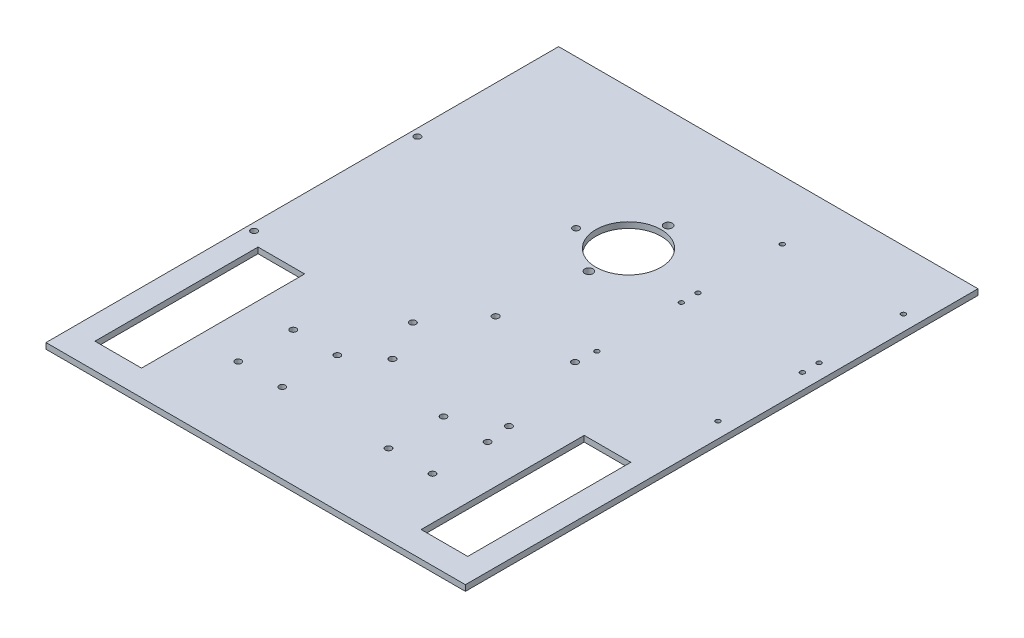
from build123d import *

# Parameters (mm, degrees)
SKETCH1_W           = 228.6
SKETCH1_H           = 279.4
BOSS_EXTRUDE1_DEPTH = 3.175
SKETCH3_R           = 1.7
SKETCH3_W           = 25.4
SKETCH3_H           = 88.9
CUT_EXTRUDE1_DEPTH  = 362.015789994
SKETCH4_R           = 17.78
SKETCH4_R_2         = 2.25
CUT_EXTRUDE2_DEPTH  = 362.015789994
SKETCH5_R           = 1.75
CUT_EXTRUDE3_DEPTH  = 362.015789994
SKETCH6_R           = 1.25
CUT_EXTRUDE4_DEPTH  = 362.015789994
SKETCH7_R           = 1.75
CUT_EXTRUDE5_DEPTH  = 362.015789994


with BuildPart() as part:
    # Sketch1 → Boss-Extrude1 (new body)
    with BuildSketch(Plane(origin=(0, 0, 0), x_dir=(1, 0, 0), z_dir=(0, 1, 0))):
        with Locations((114.3, 139.7)):
            Rectangle(SKETCH1_W, SKETCH1_H)
    extrude(amount=BOSS_EXTRUDE1_DEPTH)

    # Sketch3 → Cut-Extrude1 (cut, through all)
    with BuildSketch(Plane(origin=(0, 3.175, 0), x_dir=(1, 0, 0), z_dir=(0, 1, 0))):
        with Locations((85.34, 43.42)):
            Circle(SKETCH3_R)
        with Locations((61.34, 43.42)):
            Circle(SKETCH3_R)
        with Locations((85.34, 73.42)):
            Circle(SKETCH3_R)
        with Locations((61.34, 73.42)):
            Circle(SKETCH3_R)
        with Locations((167.26, 73.42)):
            Circle(SKETCH3_R)
        with Locations((143.26, 73.42)):
            Circle(SKETCH3_R)
        with Locations((167.26, 43.42)):
            Circle(SKETCH3_R)
        with Locations((143.26, 43.42)):
            Circle(SKETCH3_R)
        with Locations((203.2, 58.42)):
            Rectangle(SKETCH3_W, SKETCH3_H)
        with Locations((25.4, 58.42)):
            Rectangle(SKETCH3_W, SKETCH3_H)
    extrude(amount=-CUT_EXTRUDE1_DEPTH, mode=Mode.SUBTRACT)

    # Sketch4 → Cut-Extrude2 (cut, through all)
    with BuildSketch(Plane(origin=(0, 3.175, 0), x_dir=(1, 0, 0), z_dir=(0, 1, 0))):
        with Locations((114.3, 203.2)):
            Circle(SKETCH4_R)
        with Locations((114.3, 224.79)):
            Circle(SKETCH4_R_2)
        with Locations((114.3, 181.61)):
            Circle(SKETCH4_R_2)
    extrude(amount=-CUT_EXTRUDE2_DEPTH, mode=Mode.SUBTRACT)

    # Sketch5 → Cut-Extrude3 (cut, through all)
    with BuildSketch(Plane(origin=(0, 3.175, 0), x_dir=(1, 0, 0), z_dir=(0, 1, 0))):
        with Locations((90.5, 198.41)):
            Circle(SKETCH5_R)
        with Locations((90.5, 109.41)):
            Circle(SKETCH5_R)
        with Locations((4, 109.41)):
            Circle(SKETCH5_R)
        with Locations((4, 198.41)):
            Circle(SKETCH5_R)
    extrude(amount=-CUT_EXTRUDE3_DEPTH, mode=Mode.SUBTRACT)

    # Sketch6 → Cut-Extrude4 (cut, through all)
    with BuildSketch(Plane(origin=(0, 3.175, 0), x_dir=(1, 0, 0), z_dir=(0, 1, 0))):
        with Locations((154.25, 247.102093509)):
            Circle(SKETCH6_R)
        with Locations((220.25, 247.102093509)):
            Circle(SKETCH6_R)
        with Locations((220.25, 201.102093509)):
            Circle(SKETCH6_R)
        with Locations((154.25, 201.102093509)):
            Circle(SKETCH6_R)
        with Locations((220.25, 192.022093509)):
            Circle(SKETCH6_R)
        with Locations((220.25, 146.022093509)):
            Circle(SKETCH6_R)
        with Locations((154.25, 146.022093509)):
            Circle(SKETCH6_R)
        with Locations((154.25, 192.022093509)):
            Circle(SKETCH6_R)
    extrude(amount=-CUT_EXTRUDE4_DEPTH, mode=Mode.SUBTRACT)

    # Sketch7 → Cut-Extrude5 (cut, through all)
    with BuildSketch(Plane(origin=(0, 3.175, 0), x_dir=(1, 0, 0), z_dir=(0, 1, 0))):
        with Locations((110.155496986, 134.93462097)):
            Circle(SKETCH7_R)
        with Locations((153.395496986, 134.93462097)):
            Circle(SKETCH7_R)
        with Locations((102.155496986, 86.69462097)):
            Circle(SKETCH7_R)
        with Locations((165.595496986, 86.69462097)):
            Circle(SKETCH7_R)
    extrude(amount=-CUT_EXTRUDE5_DEPTH, mode=Mode.SUBTRACT)


solid = part.part
